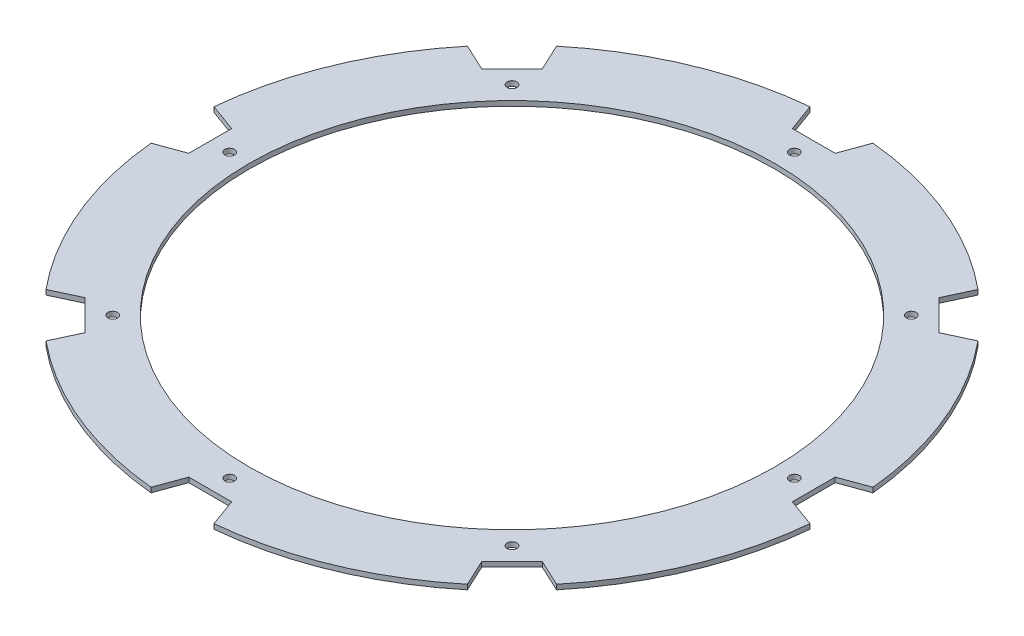
from build123d import *

# Parameters (mm, degrees)
SKETCH2_R             = 3.175
SKETCH2_R_2           = 171.45
BOSS_EXTRUDE1_DEPTH   = 3.175
CIRPATTERN1_OUTLINE_R = 3.175
CIRPATTERN1_DEPTH     = 3.175


# Read off the part's stored shape, not the designer's step: CirPattern1
with BuildPart() as part:
    # Sketch2 → Boss-Extrude1 (new body)
    with BuildSketch(Plane(origin=(0, 0, 0), x_dir=(1, 0, 0), z_dir=(0, 1, 0))):
        with BuildLine():
            Line((-214.920060182, 20.546964038), (-196.85, 13.97))
            Line((-196.85, 13.97), (-196.85, -13.97))
            Line((-196.85, -13.97), (-214.920060182, -20.546964038))
            ThreePointArc((-214.920060182, -20.546964038), (10.285159372, -215.654875894), (215.9, 0))
            ThreePointArc((215.9, 0), (10.285159372, 215.654875894), (-214.920060182, 20.546964038))
        make_face()
        with Locations(Location((-184.15, 0, 0), (0, 0, 270))):
            Circle(SKETCH2_R, mode=Mode.SUBTRACT)
        with Locations(Location((0, 0, 0), (0, 0, 270))):
            Circle(SKETCH2_R_2, mode=Mode.SUBTRACT)
    extrude(amount=BOSS_EXTRUDE1_DEPTH)

    # CirPattern1 outline → CirPattern1 (cut)
    with BuildSketch(Plane(origin=(0, 0, 0), x_dir=(1, 0, 0), z_dir=(0, 1, 0))):
        with BuildLine():
            Line((-129.315688143, 149.07225161), (-137.442534364, 166.500329572))
            ThreePointArc((-137.442534364, 166.500329572), (-152.664354058, 152.664354058), (-166.500329572, 137.442534364))
            Line((-166.500329572, 137.442534364), (-149.07225161, 129.315688143))
            Line((-149.07225161, 129.315688143), (-129.315688143, 149.07225161))
        make_face()
        with BuildLine():
            ThreePointArc((-166.500329572, -137.442534364), (-152.664354058, -152.664354058), (-137.442534364, -166.500329572))
            Line((-137.442534364, -166.500329572), (-129.315688143, -149.07225161))
            Line((-129.315688143, -149.07225161), (-149.07225161, -129.315688143))
            Line((-149.07225161, -129.315688143), (-166.500329572, -137.442534364))
        make_face()
        with BuildLine():
            ThreePointArc((-20.546964038, -214.920060182), (0, -215.9), (20.546964038, -214.920060182))
            Line((20.546964038, -214.920060182), (13.97, -196.85))
            Line((13.97, -196.85), (-13.97, -196.85))
            Line((-13.97, -196.85), (-20.546964038, -214.920060182))
        make_face()
        with BuildLine():
            ThreePointArc((137.442534364, -166.500329572), (152.664354058, -152.664354058), (166.500329572, -137.442534364))
            Line((166.500329572, -137.442534364), (149.07225161, -129.315688143))
            Line((149.07225161, -129.315688143), (129.315688143, -149.07225161))
            Line((129.315688143, -149.07225161), (137.442534364, -166.500329572))
        make_face()
        with BuildLine():
            ThreePointArc((214.920060182, -20.546964038), (215.9, 0), (214.920060182, 20.546964038))
            Line((214.920060182, 20.546964038), (196.85, 13.97))
            Line((196.85, 13.97), (196.85, -13.97))
            Line((196.85, -13.97), (214.920060182, -20.546964038))
        make_face()
        with BuildLine():
            ThreePointArc((166.500329572, 137.442534364), (152.664354058, 152.664354058), (137.442534364, 166.500329572))
            Line((137.442534364, 166.500329572), (129.315688143, 149.07225161))
            Line((129.315688143, 149.07225161), (149.07225161, 129.315688143))
            Line((149.07225161, 129.315688143), (166.500329572, 137.442534364))
        make_face()
        with BuildLine():
            ThreePointArc((20.546964038, 214.920060182), (0, 215.9), (-20.546964038, 214.920060182))
            Line((-20.546964038, 214.920060182), (-13.97, 196.85))
            Line((-13.97, 196.85), (13.97, 196.85))
            Line((13.97, 196.85), (20.546964038, 214.920060182))
        make_face()
        with Locations((-130.213713756, 130.213713756)):
            Circle(CIRPATTERN1_OUTLINE_R)
        with Locations((0, 184.15)):
            Circle(CIRPATTERN1_OUTLINE_R)
        with Locations((130.213713756, 130.213713756)):
            Circle(CIRPATTERN1_OUTLINE_R)
        with Locations((184.15, 0)):
            Circle(CIRPATTERN1_OUTLINE_R)
        with Locations((130.213713756, -130.213713756)):
            Circle(CIRPATTERN1_OUTLINE_R)
        with Locations((0, -184.15)):
            Circle(CIRPATTERN1_OUTLINE_R)
        with Locations((-130.213713756, -130.213713756)):
            Circle(CIRPATTERN1_OUTLINE_R)
    extrude(amount=CIRPATTERN1_DEPTH, mode=Mode.SUBTRACT)


solid = part.part
